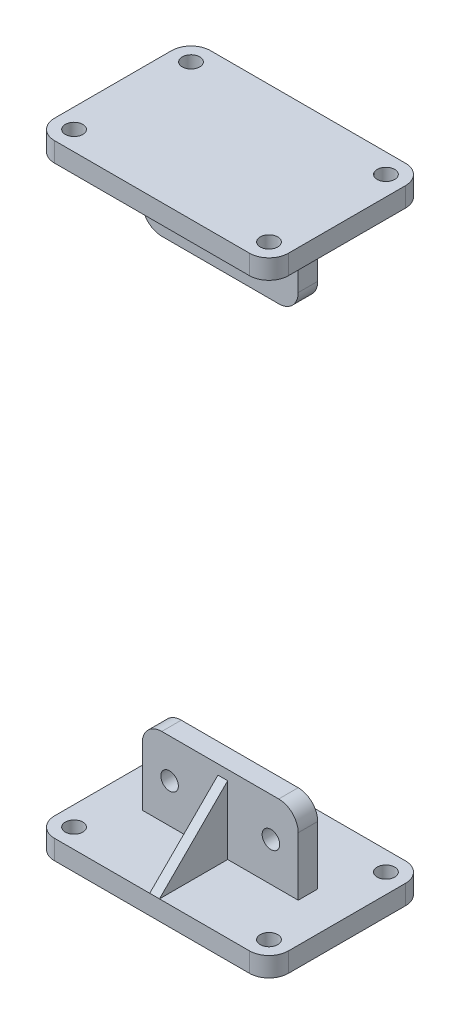
from build123d import *

# Parameters (mm, degrees)
SKETCH1_W               = 120
SKETCH1_H               = 80
BOSS_EXTRUDE1_DEPTH     = 10
FILLET1_R               = 10
FILLET2_R               = 10
FILLET3_R               = 10
FILLET4_R               = 10
CUT_EXTRUDE1_DEPTH      = 73.801098893
CUT_EXTRUDE1_DEPTH_BACK = 73.801098893
SKETCH2_R               = 4.5
SKETCH3_W               = 80
SKETCH3_H               = 10
BOSS_EXTRUDE2_DEPTH     = 40
FILLET5_R               = 10
FILLET6_R               = 10
CUT_EXTRUDE2_DEPTH      = 83.462112512
CUT_EXTRUDE2_DEPTH_BACK = 83.462112512
SKETCH4_R               = 4.5
CUT_EXTRUDE3_DEPTH      = 83.462112512
CUT_EXTRUDE3_DEPTH_BACK = 83.462112512
SKETCH9_R               = 4.5
SKETCH10_W              = 5
SKETCH10_H              = 35
BOSS_EXTRUDE4_DEPTH     = 40
CHAMFER10_START         = -54
CHAMFER10_OUTLINE_W     = 5
CHAMFER10_OUTLINE_H     = 49.497474683
CHAMFER10_DEPTH         = 25.715728753
BODY_MOVE_COPY4_ANGLE   = 180


with BuildPart() as part:
    # Sketch1 → Boss-Extrude1 (new body)
    with BuildSketch(Plane(origin=(0, 0, 0), x_dir=(1, 0, 0), z_dir=(0, 1, 0))):
        Rectangle(SKETCH1_W, SKETCH1_H)
    extrude(amount=BOSS_EXTRUDE1_DEPTH)

    # Fillet1
    fillet1_edges = [part.edges().sort_by_distance(p)[0] for p in [
        (60, 5, 40),
    ]]
    fillet(fillet1_edges, radius=FILLET1_R)

    # Fillet2
    fillet2_edges = [part.edges().sort_by_distance(p)[0] for p in [
        (-60, 5, 40),
    ]]
    fillet(fillet2_edges, radius=FILLET2_R)

    # Fillet3
    fillet3_edges = [part.edges().sort_by_distance(p)[0] for p in [
        (-60, 5, -40),
    ]]
    fillet(fillet3_edges, radius=FILLET3_R)

    # Fillet4
    fillet4_edges = [part.edges().sort_by_distance(p)[0] for p in [
        (60, 5, -40),
    ]]
    fillet(fillet4_edges, radius=FILLET4_R)

    # Sketch2 → Cut-Extrude1 (cut, two sides: drawn at the far end of the back side and taken through both)
    with BuildSketch(Plane(origin=(0, 0, 0), x_dir=(1, 0, 0), z_dir=(0, 1, 0)).offset(-CUT_EXTRUDE1_DEPTH_BACK)):
        with Locations(Location((-50, 30, 0), (0, 0, 270))):
            Circle(SKETCH2_R)
        with Locations(Location((-50, -30, 0), (0, 0, 270))):
            Circle(SKETCH2_R)
        with Locations(Location((50, -30, 0), (0, 0, 270))):
            Circle(SKETCH2_R)
        with Locations(Location((50, 30, 0), (0, 0, 270))):
            Circle(SKETCH2_R)
    extrude(amount=CUT_EXTRUDE1_DEPTH + CUT_EXTRUDE1_DEPTH_BACK, mode=Mode.SUBTRACT)

    # Sketch3 → Boss-Extrude2 (add)
    with BuildSketch(Plane(origin=(0, 0, 0), x_dir=(1, 0, 0), z_dir=(0, 1, 0))):
        Rectangle(SKETCH3_W, SKETCH3_H)
    extrude(amount=-BOSS_EXTRUDE2_DEPTH)

    # Fillet5
    fillet5_edges = [part.edges().sort_by_distance(p)[0] for p in [
        (-40, -40, 0),
    ]]
    fillet(fillet5_edges, radius=FILLET5_R)

    # Fillet6
    fillet6_edges = [part.edges().sort_by_distance(p)[0] for p in [
        (40, -40, 0),
    ]]
    fillet(fillet6_edges, radius=FILLET6_R)

    # Sketch4 → Cut-Extrude2 (cut, two sides: drawn at the far end of the back side and taken through both)
    with BuildSketch(Plane.XY.offset(-CUT_EXTRUDE2_DEPTH_BACK)):
        with Locations((-26, -20)):
            Circle(SKETCH4_R)
    extrude(amount=CUT_EXTRUDE2_DEPTH + CUT_EXTRUDE2_DEPTH_BACK, mode=Mode.SUBTRACT)

    # Sketch9 → Cut-Extrude3 (cut, two sides: drawn at the far end of the back side and taken through both)
    with BuildSketch(Plane.XY.offset(-CUT_EXTRUDE3_DEPTH_BACK)):
        with Locations((26, -20)):
            Circle(SKETCH9_R)
    extrude(amount=CUT_EXTRUDE3_DEPTH + CUT_EXTRUDE3_DEPTH_BACK, mode=Mode.SUBTRACT)

    # Sketch10 → Boss-Extrude4 (add)
    with BuildSketch(Plane.XY):
        with Locations((-1.309595444, -17.5)):
            Rectangle(SKETCH10_W, SKETCH10_H)
    extrude(amount=BOSS_EXTRUDE4_DEPTH)

    # Chamfer10: read off the stored shape, not the designer's step
    # Chamfer10 outline → Chamfer10 (cut)
    with BuildSketch(Plane(origin=(0, 0, 0), x_dir=(1, 0, 0), z_dir=(0, 0.7071067811865476, -0.7071067811865476)).offset(CHAMFER10_START)):
        with Locations((-1.309595444, -3.535533906)):
            Rectangle(CHAMFER10_OUTLINE_W, CHAMFER10_OUTLINE_H)
    extrude(amount=CHAMFER10_DEPTH, mode=Mode.SUBTRACT)


with BuildPart() as body_2:
    # Body-Move/Copy4: copy of part
    add(part.part.rotate(Axis((0, -150, 0), (0, 0, 1)), BODY_MOVE_COPY4_ANGLE))


solid = Compound([part.part, body_2.part])
